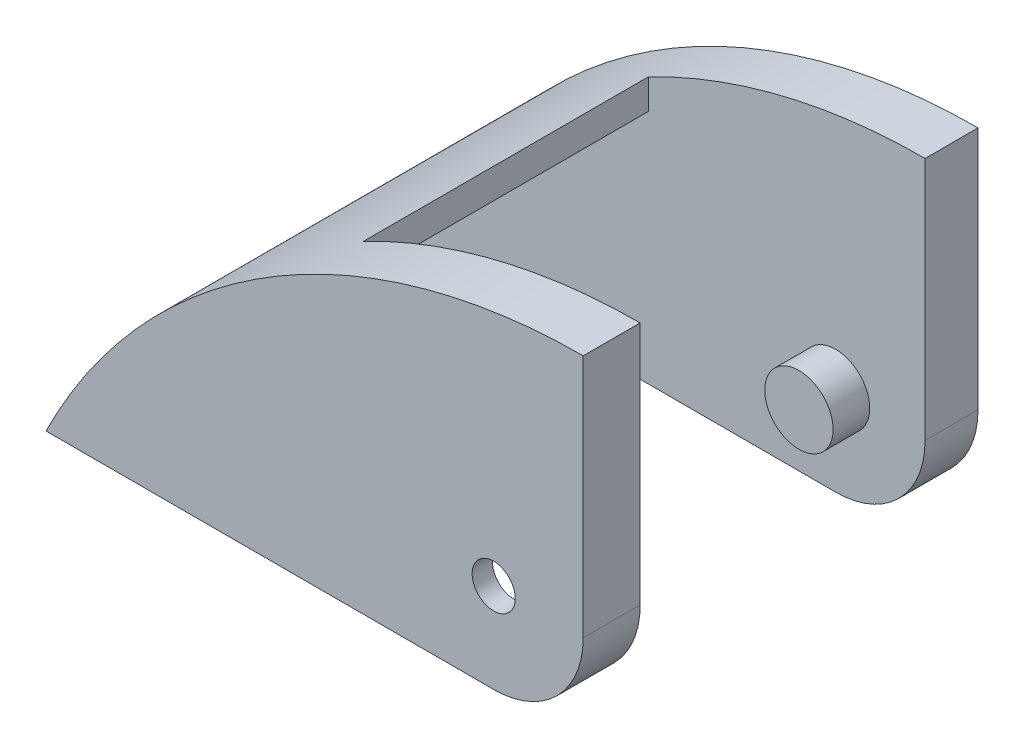
from build123d import *
from build123d.topology import SkipClean

# Parameters (mm, degrees)
SKETCH1_R              = 9.5
BOSS_EXTRUDE1_DEPTH    = 48
SKETCH2_W              = 34
SKETCH2_H              = 30
CUT_EXTRUDE1_DEPTH     = 62.481704596
BOSS_EXTRUDE2_START    = -2.5
SKETCH3_R              = 9.5
SKETCH3_R_2            = 2.4
BOSS_EXTRUDE2_DEPTH    = 2.5
SKETCH4_R              = 9.5
SKETCH4_R_2            = 4.2
BOSS_EXTRUDE3_DEPTH    = 7
SKETCH5_R              = 4.2
BOSS_EXTRUDE4_DEPTH    = 11
BOSS_EXTRUDE5_DEPTH    = 48
CUT_EXTRUDE2_START     = -48
CUT_EXTRUDE2_OUTLINE_R = 2.65
CUT_EXTRUDE2_DEPTH     = 48
CUT_EXTRUDE3_START     = -4.5
SKETCH8_R              = 9.5
CUT_EXTRUDE3_DEPTH     = 4.5
SKETCH9_R              = 6.067807638
CUT_EXTRUDE4_DEPTH     = 4.5
SKETCH10_R             = 9.5
BOSS_EXTRUDE6_DEPTH    = 4.5
SKETCH11_R             = 4.2
BOSS_EXTRUDE7_DEPTH    = 3.5
SKETCH12_R             = 2.4
BOSS_EXTRUDE8_DEPTH    = 2.5
SKETCH13_W             = 35
SKETCH13_H             = 34
CUT_EXTRUDE5_DEPTH     = 14.5
SKETCH15_R             = 3.436413098
BOSS_EXTRUDE9_DEPTH    = 10
BOSS_EXTRUDE10_DEPTH   = 0.5
SKETCH18_R             = 4.2
CUT_EXTRUDE8_DEPTH     = 0.5
CUT_EXTRUDE9_DEPTH     = 69.529190861
BOSS_EXTRUDE11_DEPTH   = 7
CUT_EXTRUDE10_DEPTH    = 80.22909819
BOSS_EXTRUDE12_DEPTH   = 41.5
SKETCH25_R             = 4.2
CUT_EXTRUDE11_DEPTH    = 0.5


# Read off the part's stored shape, not the designer's step: Cut-Extrude2
with BuildPart() as part:
    # Sketch1 → Boss-Extrude1 (new body)
    with BuildSketch(Plane.XY):
        with BuildLine():
            Line((-12, 0), (-12, 30))
            Line((-12, 30), (12, 30))
            Line((12, 30), (12, 0))
            ThreePointArc((12, 0), (0, -12), (-12, 0))
        make_face()
        Circle(SKETCH1_R, mode=Mode.SUBTRACT)
    extrude(amount=-BOSS_EXTRUDE1_DEPTH)

    # Sketch2 → Cut-Extrude1 (cut, through all)
    with BuildSketch(Plane.ZY.offset(12)):
        with Locations((-24, 3)):
            Rectangle(SKETCH2_W, SKETCH2_H)
    extrude(amount=-CUT_EXTRUDE1_DEPTH, mode=Mode.SUBTRACT)

    # Sketch3 → Boss-Extrude2 (add)
    with BuildSketch(Plane(origin=(0, 0, -48), x_dir=(-1, 0, 0), z_dir=(0, 0, -1)).offset(BOSS_EXTRUDE2_START)):
        Circle(SKETCH3_R)
        Circle(SKETCH3_R_2, mode=Mode.SUBTRACT)
    extrude(amount=BOSS_EXTRUDE2_DEPTH)

    # Sketch4 → Boss-Extrude3 (add)
    with BuildSketch(Plane.XY):
        with Locations(Location((0, 0, 0), (0, 0, 180))):
            Circle(SKETCH4_R)
        Circle(SKETCH4_R_2, mode=Mode.SUBTRACT)
    extrude(amount=-BOSS_EXTRUDE3_DEPTH)

    # Sketch5 → Boss-Extrude4 (add)
    with BuildSketch(Plane.XY):
        Circle(SKETCH5_R)
    extrude(amount=-BOSS_EXTRUDE4_DEPTH)

    # Sketch6 → Boss-Extrude5 (add)
    with BuildSketch(Plane(origin=(0, 0, -48), x_dir=(-1, 0, 0), z_dir=(0, 0, -1))):
        Polygon((12, 30), (12, 18), (18, 18), (38, 18), (38, 30), align=None)
    extrude(amount=-BOSS_EXTRUDE5_DEPTH)

    # Cut-Extrude2 outline → Cut-Extrude2 (cut)
    with BuildSketch(Plane.XY.offset(CUT_EXTRUDE2_START)):
        Circle(CUT_EXTRUDE2_OUTLINE_R)
    extrude(amount=CUT_EXTRUDE2_DEPTH, mode=Mode.SUBTRACT)

    # Sketch8 → Cut-Extrude3 (cut)
    with BuildSketch(Plane(origin=(0, 0, -7), x_dir=(-1, 0, 0), z_dir=(0, 0, -1)).offset(CUT_EXTRUDE3_START)):
        Circle(SKETCH8_R)
    extrude(amount=CUT_EXTRUDE3_DEPTH, mode=Mode.SUBTRACT)


with BuildPart() as cut_extrude3_piece_1:
    # of the separate pieces the step leaves, piece 1, a body of its own (cut_extrude3_pieces)
    add(part.part.solids().sort_by_distance((-12, 0, 0))[0])

    # Sketch10 → Boss-Extrude6 (add)
    with BuildSketch(Plane.XY.offset(-45.5)):
        with Locations(Location((0, 0, 0), (0, 0, 90))):
            Circle(SKETCH10_R)
    extrude(amount=BOSS_EXTRUDE6_DEPTH)

    # Sketch11 → Boss-Extrude7 (add)
    with BuildSketch(Plane.XY.offset(-41)):
        with Locations(Location((0, 0, 0), (0, 0, 180))):
            Circle(SKETCH11_R)
    extrude(amount=BOSS_EXTRUDE7_DEPTH)

    # Sketch12 → Boss-Extrude8 (add)
    with BuildSketch(Plane(origin=(0, 0, -48), x_dir=(-1, 0, 0), z_dir=(0, 0, -1))):
        Circle(SKETCH12_R)
    extrude(amount=-BOSS_EXTRUDE8_DEPTH)

    # Sketch13 → Cut-Extrude5 (cut)
    with BuildSketch(Plane(origin=(0, 30, 0), x_dir=(1, 0, 0), z_dir=(0, 1, 0))):
        with Locations((-5.5, 24)):
            Rectangle(SKETCH13_W, SKETCH13_H)
    extrude(amount=-CUT_EXTRUDE5_DEPTH, mode=Mode.SUBTRACT)

    # Sketch15 → Boss-Extrude9 (add)
    with BuildSketch(Plane(origin=(0, 0, -48), x_dir=(-1, 0, 0), z_dir=(0, 0, -1))):
        Circle(SKETCH15_R)
    extrude(amount=-BOSS_EXTRUDE9_DEPTH)

    # Sketch16 → Boss-Extrude10 (add)
    with SkipClean():  # the faces are left unmerged after this step: merging them gives an invalid solid
        with BuildSketch(Plane(origin=(0, 0, -48), x_dir=(-1, 0, 0), z_dir=(0, 0, -1))):
            Polygon((38, 30), (-12, 30), (-12, 18), (12, 18), (38, 18), align=None)
            with BuildLine():
                Line((-12, 0), (12, 0))
                ThreePointArc((12, 0), (0, -12), (-12, 0))
            make_face()
            with BuildLine():
                ThreePointArc((12, 0), (0, 12), (-12, 0))
                Line((-12, 0), (12, 0))
            make_face()
            with BuildLine():
                Line((12, 0), (-12, 0))
                ThreePointArc((-12, 0), (0, -12), (12, 0))
            make_face()
            with BuildLine():
                Line((12, 18), (-12, 18))
                Line((-12, 18), (-12, 0))
                ThreePointArc((-12, 0), (0, 12), (12, 0))
                Line((12, 0), (12, 18))
            make_face()
        extrude(amount=BOSS_EXTRUDE10_DEPTH)

    # Sketch18 → Cut-Extrude8 (cut)
    with SkipClean():  # the faces are left unmerged after this step: merging them gives an invalid solid
        with BuildSketch(Plane.XY.offset(-41)):
            with BuildLine():
                Line((12, 30), (-23, 30))
                Line((-23, 30), (-23, 18))
                Line((-23, 18), (-12, 18))
                Line((-12, 18), (-12, 0))
                ThreePointArc((-12, 0), (0, -12), (12, 0))
                Line((12, 0), (12, 30))
            make_face()
            Circle(SKETCH18_R, mode=Mode.SUBTRACT)
        extrude(amount=-CUT_EXTRUDE8_DEPTH, mode=Mode.SUBTRACT)

    # Sketch19 → Cut-Extrude9 (cut, through all)
    with SkipClean():  # the faces are left unmerged after this step: merging them gives an invalid solid
        with BuildSketch(Plane.XY):
            with BuildLine():
                ThreePointArc((11, 0), (0, -11), (-11, 0))
                Line((-11, 0), (-12, 0))
                ThreePointArc((-12, 0), (0, -12), (12, 0))
                Line((12, 0), (12, 30))
                Line((12, 30), (11, 30))
                Line((11, 30), (11, 0))
            make_face()
        extrude(amount=-CUT_EXTRUDE9_DEPTH, mode=Mode.SUBTRACT)

    # Sketch21 → Boss-Extrude11 (add)
    with SkipClean():  # the faces are left unmerged after this step: merging them gives an invalid solid
        with BuildSketch(Plane.XY):
            with BuildLine():
                Line((-55, -11), (0, -11))
                ThreePointArc((0, -11), (-7.778174593, -7.778174593), (-11, 0))
                Line((-11, 0), (-12, 0))
                Line((-12, 0), (-12, 18))
                Line((-12, 18), (-29.285566016, 18))
                ThreePointArc((-29.285566016, 18), (-44.085437149, 5.222560402), (-55, -11))
            make_face()
        boss_extrude11 = extrude(amount=-BOSS_EXTRUDE11_DEPTH)

    # Mirror2: Boss-Extrude11 across plane
    with SkipClean():  # the faces are left unmerged after this step: merging them gives an invalid solid
        add(boss_extrude11.mirror(Plane.XY.offset(-24.25)))

    # Sketch23 → Cut-Extrude10 (cut, through all)
    with SkipClean():  # the faces are left unmerged after this step: merging them gives an invalid solid
        with BuildSketch(Plane.XY):
            with BuildLine():
                Line((11, 30), (-38, 30))
                Line((-38, 30), (-38, 11.325220695))
                ThreePointArc((-38, 11.325220695), (-15.219016868, 25.173069355), (11, 30))
            make_face()
        extrude(amount=-CUT_EXTRUDE10_DEPTH, mode=Mode.SUBTRACT)

    # Sketch24 → Boss-Extrude12 (add)
    with SkipClean():  # the faces are left unmerged after this step: merging them gives an invalid solid
        with BuildSketch(Plane.XY):
            with BuildLine():
                ThreePointArc((-23, 21.6788275), (-41.60205739, 7.887419381), (-55, -11))
                Line((-55, -11), (-51.635998377, -11))
                ThreePointArc((-51.635998377, -11), (-39.486754135, 5.75970176), (-23, 18.276837089))
                Line((-23, 18.276837089), (-23, 21.6788275))
            make_face()
        extrude(amount=-BOSS_EXTRUDE12_DEPTH)

    # Sketch25 → Cut-Extrude11 (cut)
    # profile 1 of 3: a face of its own
    with BuildSketch(Plane.XY.offset(-41.5)):
        with BuildLine():
            ThreePointArc((11, 27), (-6.550595226, 24.784456384), (-23, 18.276837089))
            Line((-23, 18.276837089), (-23, 18))
            Line((-23, 18), (-23.499204657, 18))
            ThreePointArc((-23.499204657, 18), (-39.685914386, 5.555259732), (-51.635998377, -11))
            Line((-51.635998377, -11), (0, -11))
            ThreePointArc((0, -11), (-7.778174593, 7.778174593), (11, 0))
            Line((11, 0), (11, 27))
        make_face()
    # profile 2 of 3: a face of its own
    with BuildSketch(Plane.XY.offset(-41.5)):
        with BuildLine():
            ThreePointArc((0, -11), (7.778174593, -7.778174593), (11, 0))
            ThreePointArc((11, 0), (-7.778174593, 7.778174593), (0, -11))
        make_face()
        Circle(SKETCH25_R, mode=Mode.SUBTRACT)
    # profile 3 of 3: a face of its own
    with BuildSketch(Plane.XY.offset(-41.5)):
        with BuildLine():
            ThreePointArc((11, 30), (-6.501727856, 27.889455027), (-23, 21.6788275))
            Line((-23, 21.6788275), (-23, 18.276837089))
            ThreePointArc((-23, 18.276837089), (-6.550595226, 24.784456384), (11, 27))
            Line((11, 27), (11, 30))
        make_face()
    extrude(amount=-CUT_EXTRUDE11_DEPTH, mode=Mode.SUBTRACT)


with BuildPart() as cut_extrude3_piece_2:
    # of the separate pieces the step leaves, piece 2, a body of its own (cut_extrude3_pieces)
    add(part.part.solids().sort_by_distance((4.2, 0, -7))[0])

    # Sketch9 → Cut-Extrude4 (cut)
    with BuildSketch(Plane(origin=(0, 0, -11), x_dir=(-1, 0, 0), z_dir=(0, 0, -1))):
        Circle(SKETCH9_R)
    extrude(amount=-CUT_EXTRUDE4_DEPTH, mode=Mode.SUBTRACT)


solid = cut_extrude3_piece_1.part
